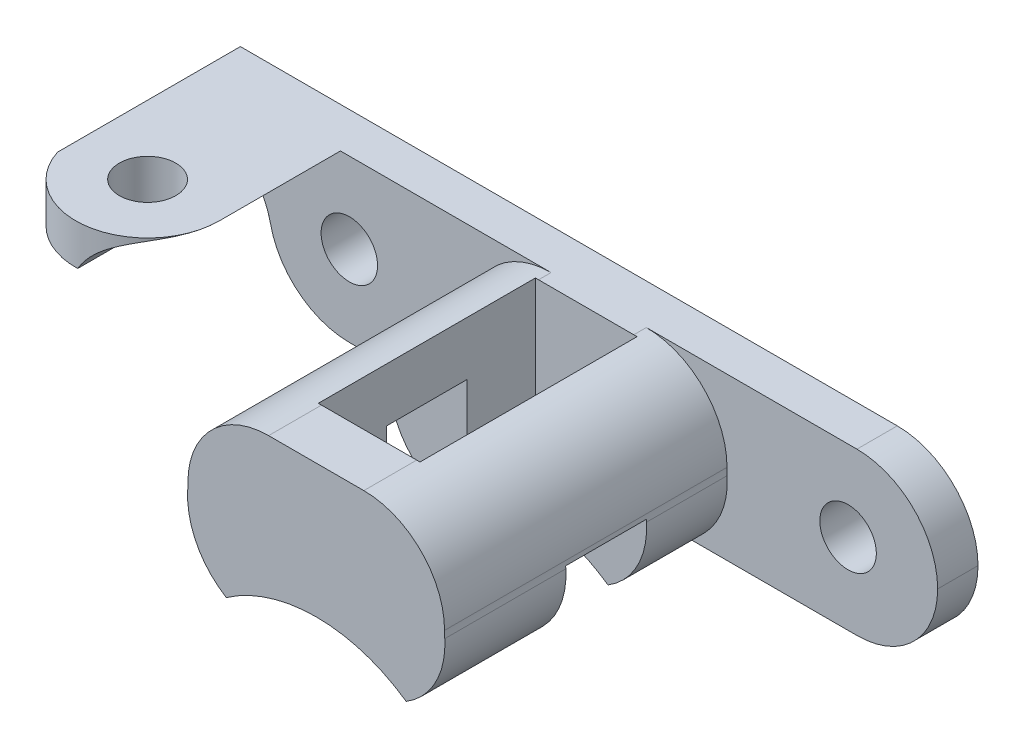
from build123d import *

# Parameters (mm, degrees)
SKETCH2_R               = 2.8000000000000056
BOSS_EXTRUDE1_DEPTH     = 20
CUT_EXTRUDE1_DEPTH      = 31.675723300355934
SKETCH4_R               = 7.499999999999999
CUT_EXTRUDE2_DEPTH      = 17.5
CUT_EXTRUDE3_DEPTH      = 2.5
CUT_EXTRUDE3_DEPTH_BACK = 2.5
SKETCH6_R               = 15
FILLET1_R               = 5
FILLET2_R               = 5
BOSS_EXTRUDE2_DEPTH     = 20
SKETCH8_R               = 1.7500000000000004
CUT_EXTRUDE4_DEPTH      = 39.87211487346831
CUT_EXTRUDE5_DEPTH      = 20
CUT_EXTRUDE6_DEPTH      = 31.68126471480597
CUT_EXTRUDE7_DEPTH      = 33.654861873847
FILLET4_R               = 5
CUT_EXTRUDE9_DEPTH      = 31.681264738273054
CUT_EXTRUDE9_DEPTH_BACK = 31.681264738273054
SKETCH13_R              = 2.8000000000000056
SKETCH13_R_2            = 1.75
SKETCH13_R_3            = 1.7500000000000002
BOSS_EXTRUDE3_DEPTH     = 2.5


# Some blends are built 0.0001 mm under size
with BuildPart() as part:
    # Sketch2 → Boss-Extrude1 (new body)
    with BuildSketch(Plane.XY):
        with BuildLine():
            Line((21, 5), (-21, 5))
            Line((-21, 5), (-21, -5))
            Line((-21, -5), (-5.57337420240183, -5))
            ThreePointArc((-5.5733742024018555, -4.999999999999908), (5.415e-14, -3.25), (5.573374202401943, -4.999999999999966))
            Line((5.573374202401933, -5), (21, -5))
            Line((21, -5), (21, 5))
        make_face()
        with Locations((-15.45, 0)):
            Circle(SKETCH2_R, mode=Mode.SUBTRACT)
        with Locations((15.45, 0)):
            Circle(SKETCH2_R, mode=Mode.SUBTRACT)
    extrude(amount=BOSS_EXTRUDE1_DEPTH)

    # Sketch3 → Cut-Extrude1 (cut, through all)
    with BuildSketch(Plane(origin=(0, 5, 0), x_dir=(1, 0, 0), z_dir=(0, 1, 0))):
        Polygon((-3.1499999999999995, -3.2750000000000004), (3.1500000000000004, -3.275), (3.1499999999999964, -16.725), (-3.1499999999999924, -16.725), align=None)
    extrude(amount=-CUT_EXTRUDE1_DEPTH, mode=Mode.SUBTRACT)

    # Sketch4 → Cut-Extrude2 (cut)
    with BuildSketch(Plane.XY.offset(20)):
        with Locations((-15.45, 0)):
            Circle(SKETCH4_R)
        with Locations((15.45, 0)):
            Circle(SKETCH4_R)
    extrude(amount=-CUT_EXTRUDE2_DEPTH, mode=Mode.SUBTRACT)

    # Sketch6 → Cut-Extrude3 (cut, two sides: drawn at the far end of the back side and taken through both)
    with BuildSketch(Plane.XY.offset(10.000000000000002).offset(-CUT_EXTRUDE3_DEPTH_BACK)):
        with Locations((1.63e-15, -13)):
            Circle(SKETCH6_R)
    extrude(amount=CUT_EXTRUDE3_DEPTH + CUT_EXTRUDE3_DEPTH_BACK, mode=Mode.SUBTRACT)

    # Fillet1
    fillet1_edges = [part.edges().sort_by_distance(p)[0] for p in [
        (21, -5, 1.25),
        (21, 5, 1.25),
        (-21, -5, 1.25),
        (-21, 5, 1.25),
    ]]
    fillet(fillet1_edges, radius=FILLET1_R - 0.0001)  # a hair under: the kernel refuses the full size

    # Fillet2
    # the kernel refuses this fillet: 5 mm, written as the material it takes off along each edge
    with BuildSketch(Plane(origin=(9.859830056250527, -5, 0.14880111239423144), x_dir=(-0.38397397843956865, 0.9233439141951876, 0), z_dir=(0, 0, 1))) as fillet2_piece_1_section:
        with BuildLine():
            CenterArc((6.587306073389745, 4.721012859383849), FILLET2_R, 188.77925307578494, 61.9904903791857)
            Line((1.6458875076078383, 3.957872926117424), (0, 0))
            ThreePointArc((0, 0), (2.470239777521158, 0.41848071092422756), (4.940479555042308, 8e-17))
        make_face()
    fillet2_piece_1 = extrude(amount=32.20239777521154, mode=Mode.PRIVATE)
    fillet2_piece_1 = split(fillet2_piece_1, bisect_by=Plane(origin=(9.859830056250527, -5, 2.5), z_dir=(0, 0, 1)), keep=Keep.TOP, mode=Mode.PRIVATE)
    add(fillet2_piece_1, mode=Mode.SUBTRACT)
    with BuildSketch(Plane(origin=(9.859830056250527, -5, 2.5), x_dir=(-1, 4.35e-15, 0), z_dir=(0, 0, 1))) as fillet2_piece_2:
        with BuildLine():
            CenterArc((6.888472612747909, -4.269602883923407), FILLET2_R, 121.35931142653445, 61.990490379185644)
            ThreePointArc((1.8970155901489643, -4.561761730354054), (1.334909412714444, -2.120195161703234), (0, 0))
            Line((0, 0), (4.286455853848589, 0))
        make_face()
    extrude(amount=17.35119888760577, mode=Mode.SUBTRACT)
    with BuildSketch(Plane(origin=(9.859830056250527, 5, 2.5), x_dir=(-0.3568220897730901, -0.9341723589627157, 0), z_dir=(0, 0, 1))) as fillet2_piece_3:
        with BuildLine():
            CenterArc((7.136441795461798, -4.670861794813579), FILLET2_R, 110.90515744788931, 90.00000000000068)
            Line((2.4655800006482402, -6.454972243679084), (0, 0))
            ThreePointArc((0, 0), (2.6761656732981733, -0.49370730777963273), (5.3523313465963485, -4e-17))
        make_face()
    extrude(amount=34.77457514062646, mode=Mode.SUBTRACT)
    with BuildSketch(Plane(origin=(-9.859830056250527, -5, 2.5), x_dir=(1, 1.077e-14, 0), z_dir=(0, 0, 1))) as fillet2_piece_4:
        with BuildLine():
            CenterArc((6.88847261274794, 4.2696028839234454), FILLET2_R, 176.65019819427988, 61.9904903791865)
            ThreePointArc((1.8970155901489953, 4.561761730354092), (1.3349094127144647, 2.1201951617032417), (0, 0))
            Line((0, 0), (4.286455853848682, 0))
        make_face()
    extrude(amount=17.351198887605886, mode=Mode.SUBTRACT)
    with BuildSketch(Plane(origin=(-9.859830056250527, -5, 0.14880111239411775), x_dir=(0.3839739784395653, 0.9233439141951888, 0), z_dir=(0, 0, 1))) as fillet2_piece_5_section:
        with BuildLine():
            CenterArc((6.587306073389805, -4.721012859383843), FILLET2_R, 109.23025654502955, 61.99049037918651)
            Line((1.645887507607885, -3.957872926117504), (0, 0))
            ThreePointArc((0, 0), (2.4702397775211735, -0.4184807109242367), (4.940479555042354, -1.7e-16))
        make_face()
    fillet2_piece_5 = extrude(amount=32.20239777521177, mode=Mode.PRIVATE)
    fillet2_piece_5 = split(fillet2_piece_5, bisect_by=Plane(origin=(-9.859830056250527, -5, 2.5), z_dir=(0, 0, 1)), keep=Keep.TOP, mode=Mode.PRIVATE)
    add(fillet2_piece_5, mode=Mode.SUBTRACT)
    with BuildSketch(Plane(origin=(-9.859830056250527, 5, 2.5), x_dir=(1, 0, 0), z_dir=(0, 0, 1))) as fillet2_piece_6:
        with BuildLine():
            CenterArc((6.909830056250634, -5), FILLET2_R, 90, 90)
            ThreePointArc((1.9098300562506338, -5.000000000000002), (1.416122748470901, -2.3238343267018453), (0, 0))
            Line((0, 0), (6.909830056250634, 0))
        make_face()
    extrude(amount=34.77457514062658, mode=Mode.SUBTRACT)

    # Sketch7 → Boss-Extrude2 (add)
    with BuildSketch(Plane(origin=(0, 0, 0), x_dir=(-1, 0, 0), z_dir=(0, 0, -1))):
        with BuildLine():
            Line((15.999999999999982, 5.000000000000001), (31.796875864400832, 5))
            Line((31.796875864400832, 5), (31.796875864400825, -4.999999999999998))
            Line((31.796875864400825, -4.999999999999998), (16, -5))
            ThreePointArc((16, -5), (19.53553390593274, -3.5355339059327413), (21, 0))
            ThreePointArc((21, 0), (19.535533905932727, 3.53553390593274), (15.999999999999982, 5.000000000000001))
        make_face()
    extrude(amount=-BOSS_EXTRUDE2_DEPTH)

    # Sketch8 → Cut-Extrude4 (cut, through all)
    with BuildSketch(Plane.XZ.offset(5)):
        with Locations(Location((-20.449999999999953, 10.000000000000002, 0), (0, 0, 270))):
            Circle(SKETCH8_R)
    extrude(amount=-CUT_EXTRUDE4_DEPTH, mode=Mode.SUBTRACT)

    # Sketch9 → Cut-Extrude5 (cut)
    with BuildSketch(Plane.XY.offset(20)):
        Polygon((-31.796875864400832, 5), (-31.796875864400825, -4.999999999999998), (-24.69999999999995, -4.999999999999998), (-24.69999999999995, 5), align=None)
    extrude(amount=-CUT_EXTRUDE5_DEPTH, mode=Mode.SUBTRACT)

    # Sketch10 → Cut-Extrude6 (cut, through all)
    with BuildSketch(Plane.XY.offset(2.5)):
        Polygon((-24.69999999999995, -4.999999999999999), (-15.999999999999948, -4.999999999999999), (-15.999999999999982, 2.5000000000000004), (-24.69999999999995, 2.5000000000000004), align=None)
    extrude(amount=CUT_EXTRUDE6_DEPTH, mode=Mode.SUBTRACT)

    # Sketch11 → Cut-Extrude7 (cut, through all)
    with BuildSketch(Plane.XZ.offset(-2.5000000000000004)):
        with BuildLine():
            Line((-20.330127018922187, 20), (-20.330127018922184, 14.448385152884956))
            ThreePointArc((-20.330127018922198, 14.448385152884956), (-17.261274959658927, 13.103954351645958), (-15.99999999999998, 10.000000000000002))
            Line((-15.999999999999982, 10.000000000000002), (-15.999999999999982, 20))
            Line((-15.999999999999982, 20), (-20.330127018922187, 20))
        make_face()
        with BuildLine():
            Line((-24.69999999999995, 20), (-24.69999999999995, 11.31909059582739))
            ThreePointArc((-24.699999999999896, 11.319090595827381), (-23.040870202135775, 13.61799552178889), (-20.330127018922198, 14.448385152884956))
            Line((-20.330127018922184, 14.448385152884956), (-20.330127018922187, 20))
            Line((-20.330127018922187, 20), (-24.69999999999995, 20))
        make_face()
    extrude(amount=-CUT_EXTRUDE7_DEPTH, mode=Mode.SUBTRACT)

    # Fillet4
    fillet4_edges = [part.edges().sort_by_distance(p)[0] for p in [
        (-22.51506350946113, 2.5000000000000004, 2.5),
    ]]
    fillet(fillet4_edges, radius=FILLET4_R)

    # Sketch12 → Cut-Extrude9 (cut, two sides: drawn at the far end of the back side and taken through both)
    with BuildSketch(Plane.XY.offset(2.5).offset(-CUT_EXTRUDE9_DEPTH_BACK)):
        with BuildLine():
            Line((-24.69999999999995, -4.999999999999999), (-21.45000000000008, -4.999999999999999))
            ThreePointArc((-21.45000000000008, -5), (-20.557799958891973, -3.5917806364070426), (-20.245833333333337, -1.9541666666666095))
            ThreePointArc((-20.245833333333337, -1.9541666666666084), (-20.269945987618247, -1.4913252879797767), (-20.34202288251563, -1.0334950976871942))
            ThreePointArc((-20.34202288251563, -1.0334950976871942), (-20.587884121097368, -0.2424121010465221), (-20.975985161662212, 0.4894605917924846))
            ThreePointArc((-20.975985161662173, 0.4894605917924937), (-20.887243562262398, -1.0558647466057054), (-20.330127018922195, -2.499999999999999))
            Line((-20.330127018922195, -2.4999999999999996), (-24.69999999999995, -2.4999999999999996))
            Line((-24.69999999999995, -2.4999999999999996), (-24.69999999999995, -4.999999999999999))
        make_face()
        with BuildLine():
            ThreePointArc((-20.975985161662212, 0.4894605917924846), (-29.137653111561168, -1.570975388197232), (-21.45000000000008, -5))
            Line((-21.45000000000008, -4.999999999999999), (-24.69999999999995, -4.999999999999999))
            Line((-24.69999999999995, -4.999999999999999), (-24.69999999999995, -2.4999999999999996))
            Line((-24.69999999999995, -2.4999999999999996), (-20.330127018922195, -2.4999999999999996))
            ThreePointArc((-20.330127018922195, -2.499999999999999), (-20.887243562262398, -1.0558647466057054), (-20.975985161662173, 0.4894605917924937))
        make_face()
        with BuildLine():
            Line((-21.45000000000008, -4.999999999999999), (-15.45, -5))
            ThreePointArc((-15.450000000000001, -5), (-18.59900972621267, -3.8837787970246174), (-20.34202288251563, -1.0334950976871942))
            ThreePointArc((-20.34202288251563, -1.0334950976871942), (-20.269945987618247, -1.4913252879797767), (-20.245833333333337, -1.9541666666666084))
            ThreePointArc((-20.245833333333337, -1.9541666666666095), (-20.557799958891973, -3.5917806364070426), (-21.45000000000008, -5))
        make_face()
    extrude(amount=CUT_EXTRUDE9_DEPTH + CUT_EXTRUDE9_DEPTH_BACK, mode=Mode.SUBTRACT)

    # Sketch13 → Boss-Extrude3 (add)
    # profile 1 of 2: a face of its own
    with BuildSketch(Plane.XY):
        with Locations((-15.45, 0)):
            Circle(SKETCH13_R)
        with Locations(Location((-15.45, 0, 0), (0, 0, 180))):
            Circle(SKETCH13_R_2, mode=Mode.SUBTRACT)
    # profile 2 of 2: a face of its own
    with BuildSketch(Plane.XY):
        with Locations((15.45, 0)):
            Circle(SKETCH13_R)
        with Locations(Location((15.45, 0, 0), (0, 0, 180))):
            Circle(SKETCH13_R_3, mode=Mode.SUBTRACT)
    extrude(amount=BOSS_EXTRUDE3_DEPTH)


solid = part.part
